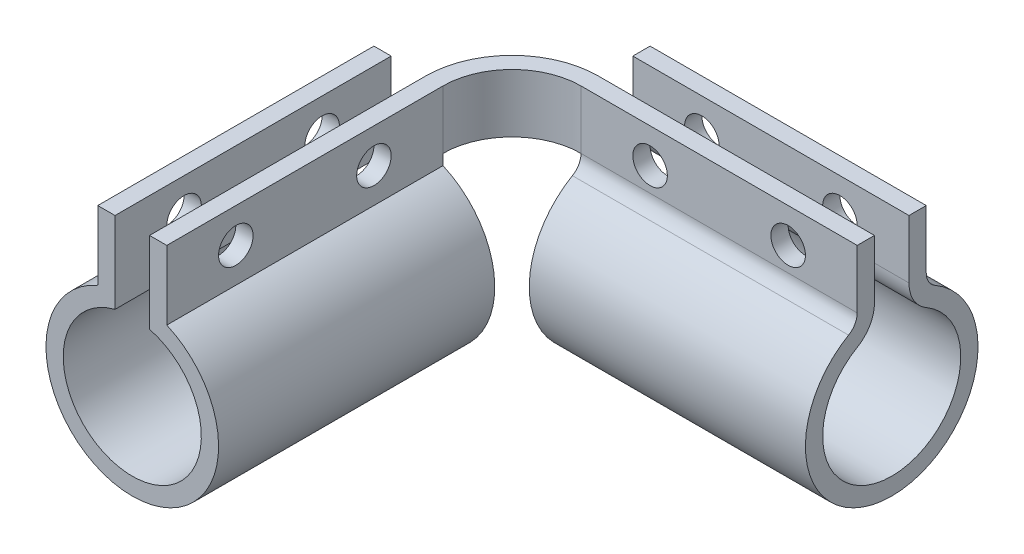
from build123d import *

# Parameters (mm, degrees)
BOSS_EXTRUDE1_DEPTH = 80
SKETCH2_R           = 5
CUT_EXTRUDE1_DEPTH  = 10
FILLET2_R           = 5
FILLET3_R           = 10
BOSS_EXTRUDE2_START = 25.98076
BOSS_EXTRUDE2_DEPTH = 16.932117
FILLET4_R           = 20
FILLET5_R           = 25
SKETCH6_W           = 5
SKETCH6_H           = 16.932118475
BOSS_EXTRUDE4_DEPTH = 80
SKETCH7_R           = 5
CUT_EXTRUDE2_DEPTH  = 40


with BuildPart() as part:
    # Sketch1 → Boss-Extrude1 (new body)
    with BuildSketch(Plane(origin=(0, 0, 0), x_dir=(0, 0, -1), z_dir=(1, 0, 0))):
        with BuildLine():
            Line((-10, 22.912878475), (-10, 42.912878475))
            Line((-10, 42.912878475), (-5, 42.912878475))
            Line((-5, 42.912878475), (-5, 19.364916731))
            ThreePointArc((-5, 19.364916731), (0, -20), (5, 19.364916731))
            Line((5, 19.364916731), (5, 42.912878475))
            Line((5, 42.912878475), (10, 42.912878475))
            Line((10, 42.912878475), (10, 22.912878475))
            ThreePointArc((10, 22.912878475), (0, -25), (-10, 22.912878475))
        make_face()
    extrude(amount=BOSS_EXTRUDE1_DEPTH)

    # Sketch2 → Cut-Extrude1 (cut, symmetric)
    with BuildSketch(Plane.XY):
        with Locations((20, 32.912878475)):
            Circle(SKETCH2_R)
        with Locations((60, 32.912878475)):
            Circle(SKETCH2_R)
    extrude(amount=CUT_EXTRUDE1_DEPTH, both=True, mode=Mode.SUBTRACT)

    # Fillet2
    fillet2_edges = [part.edges().sort_by_distance(p)[0] for p in [
        (40, 22.912878475, -10),
        (40, 22.912878475, 10),
    ]]
    fillet(fillet2_edges, radius=FILLET2_R)

    # Fillet3
    fillet3_edges = [part.edges().sort_by_distance(p)[0] for p in [
        (40, 19.364916731, 5),
        (40, 19.364916731, -5),
    ]]
    fillet(fillet3_edges, radius=FILLET3_R)

    # Sketch3 → Boss-Extrude2 (add)
    with BuildSketch(Plane(origin=(0, 0, 0), x_dir=(1, 0, 0), z_dir=(0, 1, 0)).offset(BOSS_EXTRUDE2_START)):
        Polygon((0, -10), (-20, -10), (-20, -30), (-25, -30), (-25, -5), (0, -5), align=None)
    extrude(amount=BOSS_EXTRUDE2_DEPTH)

    # Fillet4
    fillet4_edges = [part.edges().sort_by_distance(p)[0] for p in [
        (-20, 34.4468185, 10),
    ]]
    fillet(fillet4_edges, radius=FILLET4_R - 0.0001)  # a hair under: the kernel refuses the full size

    # Fillet5
    fillet5_edges = [part.edges().sort_by_distance(p)[0] for p in [
        (-25, 34.4468185, 5),
    ]]
    fillet(fillet5_edges, radius=FILLET5_R - 0.0001)  # a hair under: the kernel refuses the full size

    # Sketch6 → Boss-Extrude4 (add)
    with BuildSketch(Plane.XY.offset(30)):
        with BuildLine():
            Line((-20, 25.98076), (-25, 25.98076))
            Line((-25, 25.98076), (-25, 19.364916731))
            ThreePointArc((-25, 19.364916731), (-30, -20), (-35, 19.364916731))
            Line((-35, 19.364916731), (-35, 42.912878475))
            Line((-35, 42.912878475), (-40, 42.912878475))
            Line((-40, 42.912878475), (-40, 22.912878475))
            ThreePointArc((-40, 22.912878475), (-30, -25), (-20, 22.912878475))
            Line((-20, 22.912878475), (-20, 25.98076))
        make_face()
        with Locations((-22.5, 34.446819238)):
            Rectangle(SKETCH6_W, SKETCH6_H)
    extrude(amount=BOSS_EXTRUDE4_DEPTH)

    # Sketch7 → Cut-Extrude2 (cut)
    with BuildSketch(Plane(origin=(0, 0, 0), x_dir=(0, 0, -1), z_dir=(1, 0, 0))):
        with Locations((-90, 32.912878475)):
            Circle(SKETCH7_R)
        with Locations((-50, 32.912878475)):
            Circle(SKETCH7_R)
    extrude(amount=-CUT_EXTRUDE2_DEPTH, mode=Mode.SUBTRACT)


solid = part.part
